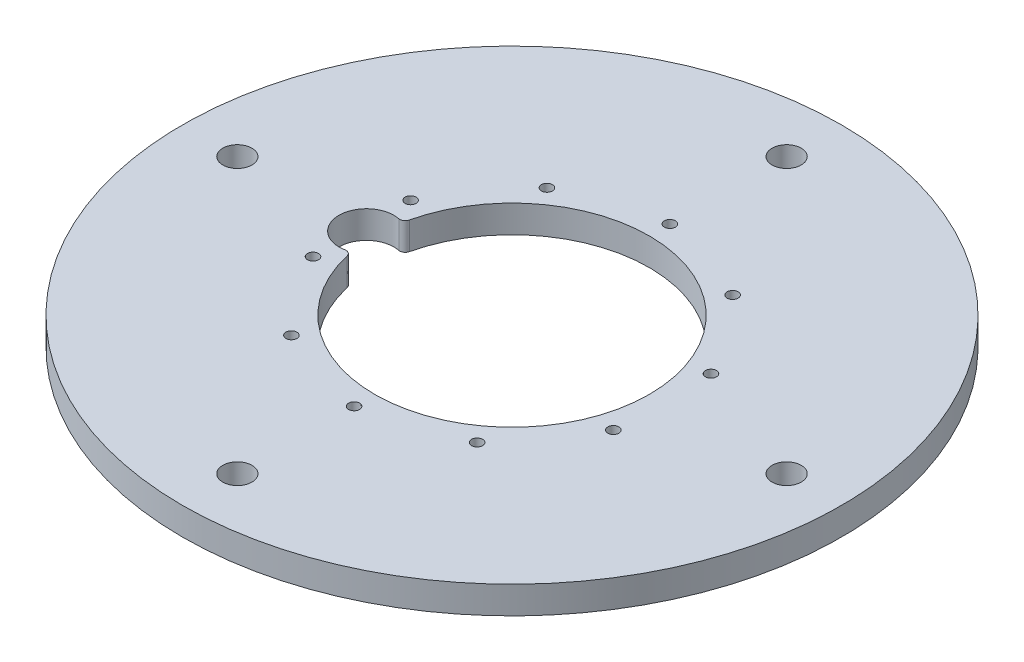
from build123d import *

# Parameters (mm, degrees)
SKETCH1_R                           = 152.4
SKETCH1_R_2                         = 63.5
THRUSTPLATE_TC3_DEPTH               = 12.7
UNDEF_CLEARANCE_THRUSTPLATE_D       = 13.49248
CLEARANCE_THRUSTPLATE_PATTERN_COUNT = 4
F_10_CLEARANCE_HOLE1_D              = 5.1054
CIRPATTERN1_COUNT                   = 10
CUT_EXTRUDE1_REACH                  = 217.9


with BuildPart() as part:
    # Sketch1 → ThrustPlate_TC3 (new body)
    with BuildSketch(Plane(origin=(0, 0, 0), x_dir=(1, 0, 0), z_dir=(0, 1, 0))):
        Circle(SKETCH1_R)
        Circle(SKETCH1_R_2, mode=Mode.SUBTRACT)
    extrude(amount=-THRUSTPLATE_TC3_DEPTH)

    # UNDEF_Clearance_ThrustPlate (through all)
    with Locations(Plane(origin=(0, 0, 0), x_dir=(1, 0, 0), z_dir=(0, 1, 0))):
        with Locations((0, 127)):
            undef_clearance_thrustplate = Hole(UNDEF_CLEARANCE_THRUSTPLATE_D / 2)

    # Clearance_ThrustPlate_Pattern: UNDEF_Clearance_ThrustPlate ×4 about axis
    clearance_thrustplate_pattern_axis = Axis((0, -12.7, 0), (0, 1, 0))
    for i in range(1, CLEARANCE_THRUSTPLATE_PATTERN_COUNT):
        add(undef_clearance_thrustplate.rotate(clearance_thrustplate_pattern_axis, i * 360 / CLEARANCE_THRUSTPLATE_PATTERN_COUNT), mode=Mode.SUBTRACT)

    # #10 Clearance Hole1 (through all)
    with Locations(Plane(origin=(0, 0, 0), x_dir=(1, 0, 0), z_dir=(0, 1, 0))):
        with Locations((0, 73.025)):
            f_10_clearance_hole1 = Hole(F_10_CLEARANCE_HOLE1_D / 2)

    # CirPattern1: #10 Clearance Hole1 ×10 about axis
    cirpattern1_axis = Axis((0, -12.7, 0), (0, 1, 0))
    for i in range(1, CIRPATTERN1_COUNT):
        add(f_10_clearance_hole1.rotate(cirpattern1_axis, i * 360 / CIRPATTERN1_COUNT), mode=Mode.SUBTRACT)

    # Sketch24 → Cut-Extrude1 (cut, up to next)
    with BuildSketch(Plane(origin=(0, 0, 0), x_dir=(1, 0, 0), z_dir=(0, 1, 0)), mode=Mode.PRIVATE) as cut_extrude1_sk1:
        with BuildLine():
            ThreePointArc((-64.823915094, 12.454291704), (-80.01, 0), (-64.823915094, -12.454291704))
            ThreePointArc((-64.823915094, -12.454291704), (-62.950170838, -12.810490198), (-61.85259434, -14.370336581))
            ThreePointArc((-61.85259434, -14.370336581), (-63.5, 0), (-61.85259434, 14.370336581))
            ThreePointArc((-61.85259434, 14.370336581), (-62.950170838, 12.810490198), (-64.823915094, 12.454291704))
        make_face()
    cut_extrude1_tool1 = extrude(cut_extrude1_sk1.sketch, amount=-CUT_EXTRUDE1_REACH, mode=Mode.PRIVATE) & part.part
    add(cut_extrude1_tool1.solids().sort_by_distance((-70.456081, 0, 0))[0], mode=Mode.SUBTRACT)


solid = part.part
